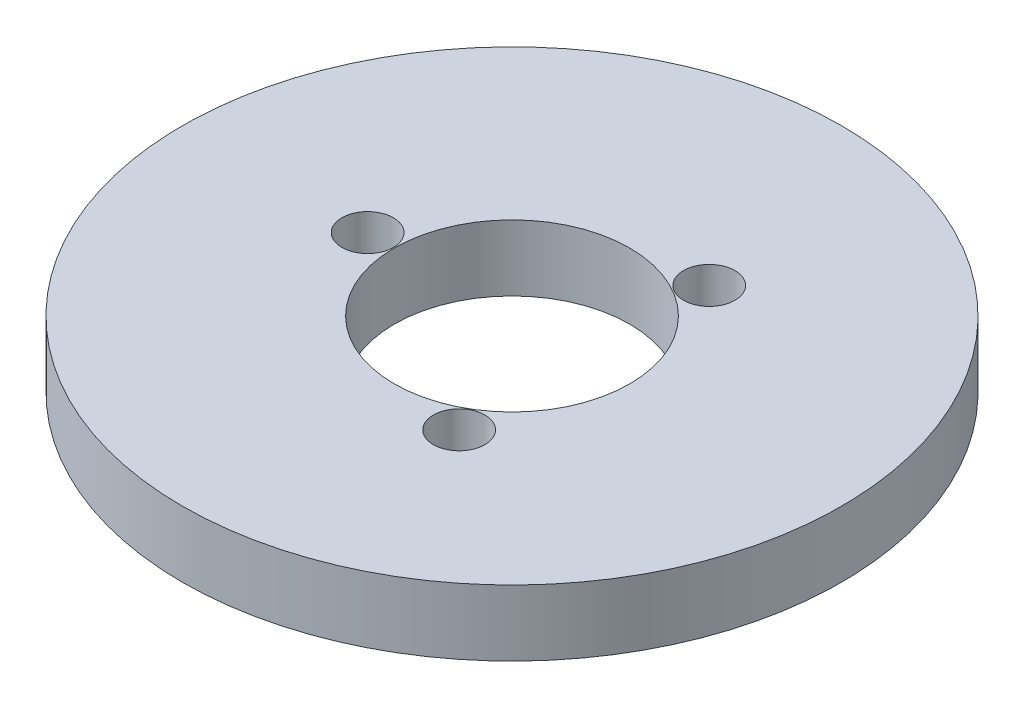
from build123d import *

# Parameters (mm, degrees)
SKETCH1_R           = 35
BOSS_EXTRUDE1_DEPTH = 7
SKETCH2_R           = 12.5
CUT_EXTRUDE1_DEPTH  = 50.989999
SKETCH3_R           = 2.734497858
CUT_EXTRUDE2_DEPTH  = 5.523438113
CIRPATTERN1_COUNT   = 3


with BuildPart() as part:
    # Sketch1 → Boss-Extrude1 (new body)
    with BuildSketch(Plane(origin=(0, 0, 0), x_dir=(1, 0, 0), z_dir=(0, 1, 0))):
        Circle(SKETCH1_R)
    extrude(amount=BOSS_EXTRUDE1_DEPTH)

    # Sketch2 → Cut-Extrude1 (cut, through all)
    with BuildSketch(Plane(origin=(0, 0, 0), x_dir=(1, 0, 0), z_dir=(0, 1, 0))):
        Circle(SKETCH2_R)
    extrude(amount=CUT_EXTRUDE1_DEPTH, mode=Mode.SUBTRACT)

    # Sketch3 → Cut-Extrude2 (cut)
    with BuildSketch(Plane(origin=(0, 7, 0), x_dir=(1, 0, 0), z_dir=(0, 1, 0))):
        with Locations((-15.333559702, 0)):
            Circle(SKETCH3_R)
    cut_extrude2 = extrude(amount=-CUT_EXTRUDE2_DEPTH, mode=Mode.SUBTRACT)

    # CirPattern1: Cut-Extrude2 ×3 about axis
    cirpattern1_axis = Axis((0, 0, 0), (0, 1, 0))
    for i in range(1, CIRPATTERN1_COUNT):
        add(cut_extrude2.rotate(cirpattern1_axis, i * 360 / CIRPATTERN1_COUNT), mode=Mode.SUBTRACT)


solid = part.part
